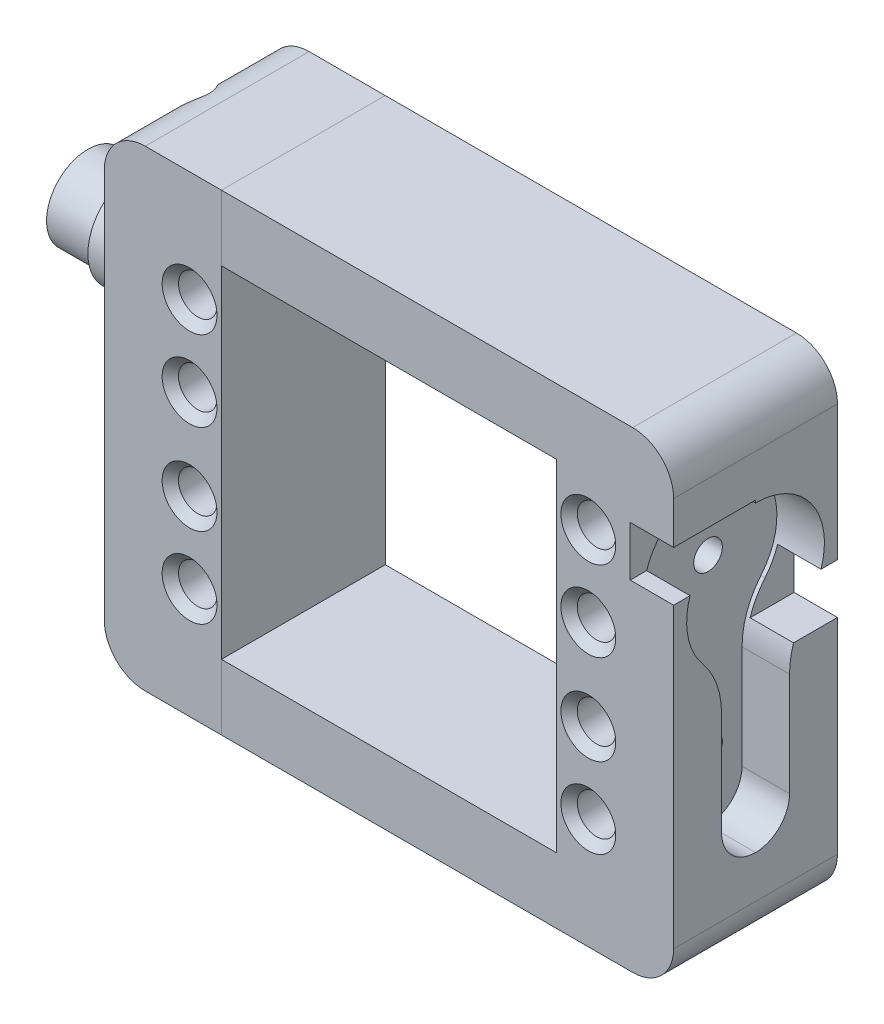
from build123d import *

# Parameters (mm, degrees)
SKETCH1_W              = 20
SKETCH1_H              = 20
BOSS_EXTRUDE1_DEPTH    = 20
SKETCH2_W              = 20
SKETCH2_H              = 70
BOSS_EXTRUDE2_DEPTH    = 10.3
CUT_EXTRUDE1_DEPTH     = 5.8
FILLET1_R              = 4.15
FILLET2_R              = 10
SKETCH5_R              = 1.75
CUT_EXTRUDE2_DEPTH     = 48.361271098
CUT_EXTRUDE3_REACH     = 45.878
SKETCH6_R              = 1.75
SKETCH13_W             = 20
SKETCH13_H             = 20
CUT_EXTRUDE9_DEPTH     = 20
CUT_EXTRUDE18_DEPTH    = 5.3
SKETCH32_W             = 20
SKETCH32_H             = 3.725
BOSS_EXTRUDE3_DEPTH    = 10.3
SKETCH31_W             = 20
SKETCH31_H             = 16.125
CUT_EXTRUDE19_DEPTH    = 42.300310229
SKETCH34_W             = 20
SKETCH34_H             = 57.6
SKETCH34_R             = 1.75
BOSS_EXTRUDE5_DEPTH    = 4
SKETCH35_W             = 20
SKETCH35_H             = 8
BOSS_EXTRUDE6_DEPTH    = 40.9
SKETCH37_W             = 20
SKETCH37_H             = 57.6
BOSS_EXTRUDE7_DEPTH    = 14.3
SKETCH38_R             = 2.35
CUT_EXTRUDE20_DEPTH    = 8
CHAMFER1_SIZE          = 1
SKETCH41_R             = 3.5
CUT_EXTRUDE23_DEPTH    = 4
SKETCH42_R             = 1.75
CUT_EXTRUDE24_DEPTH    = 22.3
SKETCH43_R             = 3.5
CUT_EXTRUDE25_DEPTH    = 11
FILLET3_R              = 5
SPLIT1_SURFACE_1_BACK  = 93.455
SPLIT1_SURFACE_1_DEPTH = 186.91
SPLIT1_SURFACE_2_BACK  = 93.455
SPLIT1_SURFACE_2_DEPTH = 186.91
SKETCH45_R             = 2.35
CUT_EXTRUDE26_DEPTH    = 8
CHAMFER2_SIZE          = 1
SKETCH46_R             = 5.05
BOSS_EXTRUDE8_DEPTH    = 12
SKETCH50_R             = 6
BOSS_EXTRUDE9_DEPTH    = 6
FILLET6_R              = 3


# Some blends are built 0.0001 mm under size
with BuildPart() as part:
    # Sketch1 → Boss-Extrude1 (new body)
    with BuildSketch(Plane(origin=(0, 0, 0), x_dir=(0, 0, -1), z_dir=(1, 0, 0))):
        Rectangle(SKETCH1_W, SKETCH1_H)
    extrude(amount=BOSS_EXTRUDE1_DEPTH)

    # Sketch2 → Boss-Extrude2 (add)
    with BuildSketch(Plane(origin=(20, 0, 0), x_dir=(0, 0, -1), z_dir=(1, 0, 0))):
        Rectangle(SKETCH2_W, SKETCH2_H)
    extrude(amount=BOSS_EXTRUDE2_DEPTH)

    # Sketch4 → Cut-Extrude1 (cut)
    with BuildSketch(Plane(origin=(30.3, 0, 0), x_dir=(0, 0, -1), z_dir=(1, 0, 0))):
        with BuildLine():
            Line((4.15, -28.55), (-4.15, -28.55))
            Line((-4.15, -28.55), (-4.15, -7.311805523))
            ThreePointArc((-4.15, -7.311805523), (0, 8.407437184), (4.15, -7.311805523))
            Line((4.15, -7.311805523), (4.15, -28.55))
        make_face()
    extrude(amount=-CUT_EXTRUDE1_DEPTH, mode=Mode.SUBTRACT)

    # Fillet1
    fillet1_edges = [part.edges().sort_by_distance(p)[0] for p in [
        (27.4, -28.55, 4.15),
        (27.4, -28.55, -4.15),
    ]]
    fillet(fillet1_edges, radius=FILLET1_R - 0.0001)  # a hair under: the kernel refuses the full size

    # Fillet2
    fillet2_edges = [part.edges().sort_by_distance(p)[0] for p in [
        (27.4, -7.311805523, 4.15),
        (27.4, -7.311805523, -4.15),
    ]]
    fillet(fillet2_edges, radius=FILLET2_R)

    # Sketch5 → Cut-Extrude2 (cut, through all)
    with BuildSketch(Plane.ZY):
        Circle(SKETCH5_R)
    extrude(amount=-CUT_EXTRUDE2_DEPTH, mode=Mode.SUBTRACT)

    # Sketch6 → Cut-Extrude3 (cut, up to next)
    with BuildSketch(Plane(origin=(24.5, 0, 0), x_dir=(0, 0, -1), z_dir=(1, 0, 0)), mode=Mode.PRIVATE) as cut_extrude3_sk1:
        with Locations((0, -20.6)):
            Circle(SKETCH6_R)
    cut_extrude3_tool1 = extrude(cut_extrude3_sk1.sketch, amount=-CUT_EXTRUDE3_REACH, mode=Mode.PRIVATE) & part.part
    add(cut_extrude3_tool1.solids().sort_by_distance((24.5, -20.6, 0))[0], mode=Mode.SUBTRACT)

    # Sketch13 → Cut-Extrude9 (cut)
    with BuildSketch(Plane.ZY):
        Rectangle(SKETCH13_W, SKETCH13_H)
    extrude(amount=-CUT_EXTRUDE9_DEPTH, mode=Mode.SUBTRACT)

    # Sketch29 → Cut-Extrude18 (cut)
    with BuildSketch(Plane(origin=(30.3, 0, 0), x_dir=(0, 0, -1), z_dir=(1, 0, 0))):
        Polygon((15.109449768, -8.7), (15.109449768, -2.6), (0, -2.6), (0, -3.8), (0, -7.5), (0, -8.7), align=None)
        Polygon((0, 2.6), (-15.109449768, 2.6), (-15.109449768, 8.7), (0, 8.7), (0, 7.5), (0, 3.8), align=None)
    extrude(amount=-CUT_EXTRUDE18_DEPTH, mode=Mode.SUBTRACT)

    # Sketch32 → Boss-Extrude3 (add)
    with BuildSketch(Plane(origin=(30.3, 0, 0), x_dir=(0, 0, -1), z_dir=(1, 0, 0))):
        with Locations((0, -36.8625)):
            Rectangle(SKETCH32_W, SKETCH32_H)
    extrude(amount=-BOSS_EXTRUDE3_DEPTH)

    # Sketch31 → Cut-Extrude19 (cut, through all)
    with BuildSketch(Plane(origin=(30.3, 0, 0), x_dir=(0, 0, -1), z_dir=(1, 0, 0))):
        with Locations((0, 26.9375)):
            Rectangle(SKETCH31_W, SKETCH31_H)
    extrude(amount=-CUT_EXTRUDE19_DEPTH, mode=Mode.SUBTRACT)

    # Sketch34 → Boss-Extrude5 (add)
    with BuildSketch(Plane.ZY.offset(-20)):
        with Locations((0, -9.925)):
            Rectangle(SKETCH34_W, SKETCH34_H)
        with Locations(Location((0, -20.6, 0), (0, 0, 180))):
            Circle(SKETCH34_R, mode=Mode.SUBTRACT)
        Circle(SKETCH34_R, mode=Mode.SUBTRACT)
    extrude(amount=BOSS_EXTRUDE5_DEPTH)

    # Sketch35 → Boss-Extrude6 (add)
    with BuildSketch(Plane.ZY.offset(-16)):
        with Locations((0, 14.875)):
            Rectangle(SKETCH35_W, SKETCH35_H)
        with Locations((0, -34.725)):
            Rectangle(SKETCH35_W, SKETCH35_H)
    extrude(amount=BOSS_EXTRUDE6_DEPTH)

    # Sketch37 → Boss-Extrude7 (add)
    with BuildSketch(Plane.ZY.offset(24.9)):
        with Locations((0, -9.925)):
            Rectangle(SKETCH37_W, SKETCH37_H)
    extrude(amount=BOSS_EXTRUDE7_DEPTH)

    # Sketch38 → Cut-Extrude20 (cut)
    with BuildSketch(Plane.XY.offset(10)):
        with Locations((-28.79, 5.375)):
            Circle(SKETCH38_R)
        with Locations(Location((-28.79, -4.425, 0), (0, 0, 180))):
            Circle(SKETCH38_R)
        with Locations(Location((-28.79, -25.225, 0), (0, 0, 180))):
            Circle(SKETCH38_R)
        with Locations((-28.79, -15.425)):
            Circle(SKETCH38_R)
        with Locations(Location((19.89, 5.375, 0), (0, 0, 180))):
            Circle(SKETCH38_R)
        with Locations((19.89, -4.425)):
            Circle(SKETCH38_R)
        with Locations(Location((19.89, -15.425, 0), (0, 0, 180))):
            Circle(SKETCH38_R)
        with Locations((19.89, -25.225)):
            Circle(SKETCH38_R)
    extrude(amount=-CUT_EXTRUDE20_DEPTH, mode=Mode.SUBTRACT)

    # Chamfer1
    chamfer1_edges = [part.edges().sort_by_distance(p)[0] for p in [
        (22.24, 5.375, 10),
        (-31.14, -15.425, 10),
        (-26.44, -25.225, 10),
        (-26.44, -4.425, 10),
        (17.54, -4.425, 10),
        (22.24, -15.425, 10),
        (17.54, -25.225, 10),
        (-31.14, 5.375, 10),
    ]]
    chamfer(chamfer1_edges, length=CHAMFER1_SIZE)

    # Sketch41 → Cut-Extrude23 (cut)
    with BuildSketch(Plane.ZY.offset(-16)):
        Circle(SKETCH41_R)
        with Locations((0, -20.6)):
            Circle(SKETCH41_R)
    extrude(amount=-CUT_EXTRUDE23_DEPTH, mode=Mode.SUBTRACT)

    # Sketch42 → Cut-Extrude24 (cut)
    with BuildSketch(Plane.ZY.offset(39.2)):
        with Locations((0, -34.725)):
            Circle(SKETCH42_R)
        with Locations(Location((0, 14.875, 0), (0, 0, 180))):
            Circle(SKETCH42_R)
    extrude(amount=-CUT_EXTRUDE24_DEPTH, mode=Mode.SUBTRACT)

    # Sketch43 → Cut-Extrude25 (cut)
    with BuildSketch(Plane.ZY.offset(39.2)):
        with Locations((0, 14.875)):
            Circle(SKETCH43_R)
        with Locations((0, -34.725)):
            Circle(SKETCH43_R)
    extrude(amount=-CUT_EXTRUDE25_DEPTH, mode=Mode.SUBTRACT)

    # Fillet3
    # the kernel refuses this fillet: 5 mm, written as the material it takes off along each edge
    with BuildSketch(Plane(origin=(30.3, -38.725, -22.5), x_dir=(-1, 0, 0), z_dir=(0, 0, 1)), Plane(origin=(-39.2, 18.875, -22.5), x_dir=(1, 0, 0), z_dir=(0, 0, 1))) as fillet3_piece_1:
        with BuildLine():
            CenterArc((FILLET3_R, -FILLET3_R), FILLET3_R, 90, 90)
            Line((0, -FILLET3_R), (0, 0))
            Line((0, 0), (FILLET3_R, 0))
        make_face()
    extrude(amount=45, mode=Mode.SUBTRACT)
    with BuildSketch(Plane(origin=(30.3, 18.875, -22.5), x_dir=(-1, 0, 0), z_dir=(0, 0, 1)), Plane(origin=(-39.2, -38.725, 22.5), x_dir=(0, 1, 0), z_dir=(0, 0, -1))) as fillet3_piece_2:
        with BuildLine():
            CenterArc((FILLET3_R, FILLET3_R), FILLET3_R, 180, 90)
            Line((0, FILLET3_R), (0, 0))
            Line((0, 0), (FILLET3_R, 0))
        make_face()
    extrude(amount=45, mode=Mode.SUBTRACT)


with BuildPart() as body_2:
    # Split1: the piece behind the surface
    add(part.part)
    # Split1 surface: a surface, the sketch's curves swept straight by 186.91 mm
    with BuildLine(Plane.XY.offset(10).offset(-SPLIT1_SURFACE_1_BACK), mode=Mode.PRIVATE) as split1_surface_1_path:
        Line((-24.9, 18.875), (-24.9, -38.725))
    split1_surface_1 = Shell.extrude(split1_surface_1_path.wire(), (0 * SPLIT1_SURFACE_1_DEPTH, 0 * SPLIT1_SURFACE_1_DEPTH, 1 * SPLIT1_SURFACE_1_DEPTH))
    split(bisect_by=split1_surface_1, keep=Keep.BOTTOM)

    # Sketch46 → Boss-Extrude8 (add)
    with BuildSketch(Plane.ZY.offset(39.2)):
        Circle(SKETCH46_R)
    extrude(amount=BOSS_EXTRUDE8_DEPTH)

    # Sketch50 → Boss-Extrude9 (add)
    with BuildSketch(Plane.ZY.offset(39.2)):
        Circle(SKETCH50_R)
    extrude(amount=BOSS_EXTRUDE9_DEPTH)

    # Fillet6
    fillet6_edges = [body_2.edges().sort_by_distance(p)[0] for p in [
        (-39.2, 0, -6),
    ]]
    fillet(fillet6_edges, radius=FILLET6_R)


with BuildPart() as part_1:
    add(part.part)

    # Split1: split by a surface, the side it looks to stays
    # Split1 surface: a surface, the sketch's curves swept straight by 186.91 mm
    with BuildLine(Plane.XY.offset(10).offset(-SPLIT1_SURFACE_2_BACK), mode=Mode.PRIVATE) as split1_surface_2_path:
        Line((-24.9, 18.875), (-24.9, -38.725))
    split1_surface_2 = Shell.extrude(split1_surface_2_path.wire(), (0 * SPLIT1_SURFACE_2_DEPTH, 0 * SPLIT1_SURFACE_2_DEPTH, 1 * SPLIT1_SURFACE_2_DEPTH))
    split(bisect_by=split1_surface_2, keep=Keep.TOP)

    # Sketch45 → Cut-Extrude26 (cut)
    with BuildSketch(Plane.ZY.offset(24.9)):
        with Locations((0, 14.875)):
            Circle(SKETCH45_R)
        with Locations((0, -34.725)):
            Circle(SKETCH45_R)
    extrude(amount=-CUT_EXTRUDE26_DEPTH, mode=Mode.SUBTRACT)

    # Chamfer2
    chamfer2_edges = [part_1.edges().sort_by_distance(p)[0] for p in [
        (-24.9, 14.875, -2.35),
        (-24.9, -34.725, -2.35),
    ]]
    chamfer(chamfer2_edges, length=CHAMFER2_SIZE)


solid = Compound([body_2.part, part_1.part])
